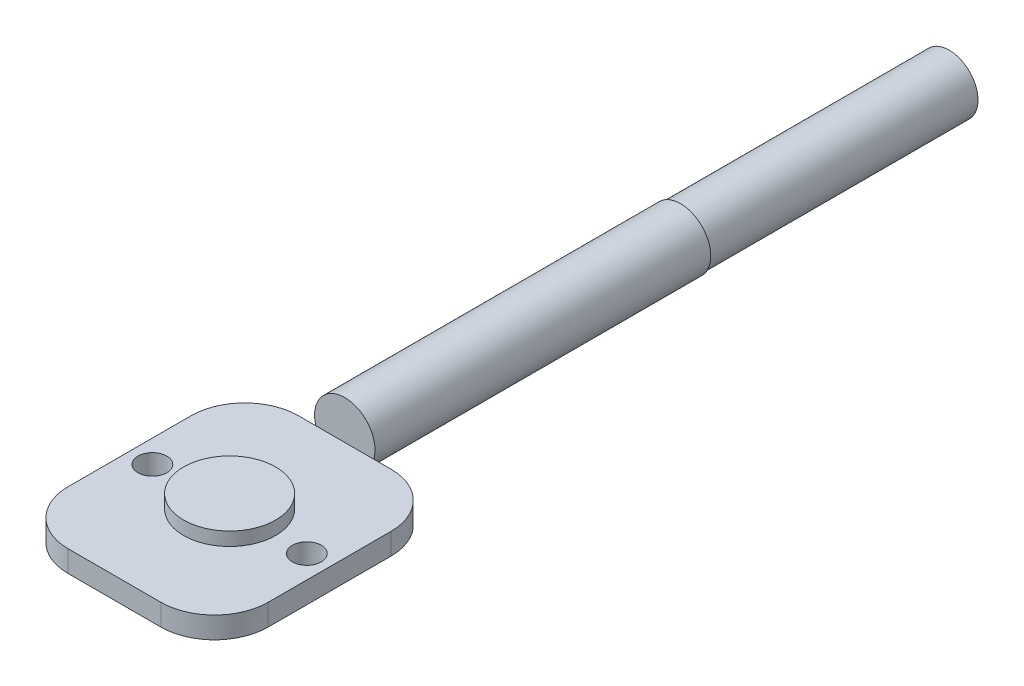
from build123d import *

# Parameters (mm, degrees)
SKETCH1_R           = 1.075
BOSS_EXTRUDE1_DEPTH = 1.6
SKETCH2_R           = 3.426475787
BOSS_EXTRUDE2_DEPTH = 1
SKETCH4_R           = 2.25
BOSS_EXTRUDE3_DEPTH = 25
SKETCH5_R           = 2.15
BOSS_EXTRUDE4_DEPTH = 20


with BuildPart() as part:
    # Sketch1 → Boss-Extrude1 (new body)
    with BuildSketch(Plane(origin=(0, 0, 0), x_dir=(1, 0, 0), z_dir=(0, 1, 0))):
        with BuildLine():
            Line((-3.45, 8.575), (3.45, 8.575))
            ThreePointArc((3.45, 8.575), (6.278427125, 7.403427125), (7.45, 4.575))
            Line((7.45, 4.575), (7.45, -4.575))
            ThreePointArc((7.45, -4.575), (6.278427125, -7.403427125), (3.45, -8.575))
            Line((3.45, -8.575), (-3.45, -8.575))
            ThreePointArc((-3.45, -8.575), (-6.278427125, -7.403427125), (-7.45, -4.575))
            Line((-7.45, -4.575), (-7.45, 4.575))
            ThreePointArc((-7.45, 4.575), (-6.278427125, 7.403427125), (-3.45, 8.575))
        make_face()
        with Locations((-5.75, 0)):
            Circle(SKETCH1_R, mode=Mode.SUBTRACT)
        with Locations((5.75, 0)):
            Circle(SKETCH1_R, mode=Mode.SUBTRACT)
    extrude(amount=BOSS_EXTRUDE1_DEPTH)

    # Sketch2 → Boss-Extrude2 (add)
    with BuildSketch(Plane(origin=(0, 1.6, 0), x_dir=(1, 0, 0), z_dir=(0, 1, 0))):
        Circle(SKETCH2_R)
    extrude(amount=BOSS_EXTRUDE2_DEPTH)


with BuildPart() as body_2:
    # Sketch4 → Boss-Extrude3 (new body)
    with BuildSketch(Plane(origin=(0, 0, -8.575), x_dir=(-1, 0, 0), z_dir=(0, 0, -1))):
        with Locations((0, 2.25)):
            Circle(SKETCH4_R)
    extrude(amount=BOSS_EXTRUDE3_DEPTH)

    # Sketch5 → Boss-Extrude4 (add)
    with BuildSketch(Plane(origin=(0, 0, -33.575), x_dir=(-1, 0, 0), z_dir=(0, 0, -1))):
        with Locations((0, 2.25)):
            Circle(SKETCH5_R)
    extrude(amount=BOSS_EXTRUDE4_DEPTH)


solid = Compound([part.part, body_2.part])
